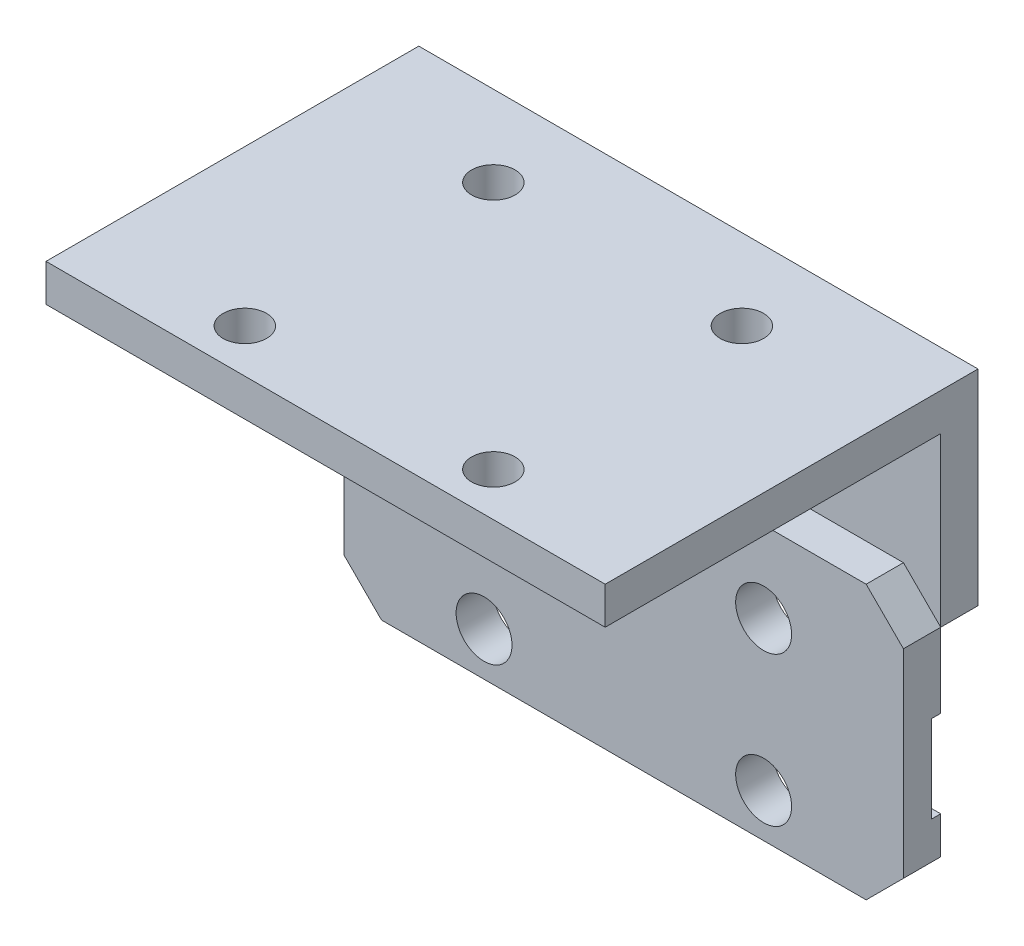
from build123d import *

# Parameters (mm, degrees)
SKETCH1_W                      = 45
SKETCH1_H                      = 27
BOSS_EXTRUDE1_DEPTH            = 3
CUT_EXTRUDE1_REACH             = 28.41
SKETCH2_R                      = 1.75
SKETCH3_W                      = 45
SKETCH3_H                      = 35.5
BOSS_EXTRUDE2_DEPTH            = 3
SKETCH4_W                      = 45
SKETCH4_H                      = 22
BOSS_EXTRUDE3_DEPTH            = 3
SKETCH6_W                      = 45
SKETCH6_H                      = 19
CUT_EXTRUDE2_DEPTH             = 3
SKETCH7_W                      = 1
SKETCH7_H                      = 7
CUT_EXTRUDE3_DEPTH             = 1.5
SKETCH8_W                      = 45
SKETCH8_H                      = 7
CUT_EXTRUDE4_DEPTH             = 0.75
CUT_EXTRUDE5_REACH             = 49.87
SKETCH10_R                     = 2.25
CUT_EXTRUDE5_DIRECTION_2_DEPTH = 48.86961458
CHAMFER1_SIZE                  = 3


with BuildPart() as part:
    # Sketch1 → Boss-Extrude1 (new body)
    with BuildSketch(Plane(origin=(0, 0, 0), x_dir=(1, 0, 0), z_dir=(0, 1, 0))):
        Rectangle(SKETCH1_W, SKETCH1_H)
    extrude(amount=BOSS_EXTRUDE1_DEPTH)

    # Sketch2 → Cut-Extrude1 (cut, up to next)
    with BuildSketch(Plane(origin=(0, 3, 0), x_dir=(1, 0, 0), z_dir=(0, 1, 0)), mode=Mode.PRIVATE) as cut_extrude1_sk1:
        with Locations(Location((-10, 10, 0), (0, 0, 270))):
            Circle(SKETCH2_R)
    cut_extrude1_tool1 = extrude(cut_extrude1_sk1.sketch, amount=-CUT_EXTRUDE1_REACH, mode=Mode.PRIVATE) & part.part
    # Sketch2 → Cut-Extrude1 (cut, up to next)
    with BuildSketch(Plane(origin=(0, 3, 0), x_dir=(1, 0, 0), z_dir=(0, 1, 0)), mode=Mode.PRIVATE) as cut_extrude1_sk2:
        with Locations(Location((10, 10, 0), (0, 0, 270))):
            Circle(SKETCH2_R)
    cut_extrude1_tool2 = extrude(cut_extrude1_sk2.sketch, amount=-CUT_EXTRUDE1_REACH, mode=Mode.PRIVATE) & part.part
    # Sketch2 → Cut-Extrude1 (cut, up to next)
    with BuildSketch(Plane(origin=(0, 3, 0), x_dir=(1, 0, 0), z_dir=(0, 1, 0)), mode=Mode.PRIVATE) as cut_extrude1_sk3:
        with Locations(Location((10, -10, 0), (0, 0, 270))):
            Circle(SKETCH2_R)
    cut_extrude1_tool3 = extrude(cut_extrude1_sk3.sketch, amount=-CUT_EXTRUDE1_REACH, mode=Mode.PRIVATE) & part.part
    # Sketch2 → Cut-Extrude1 (cut, up to next)
    with BuildSketch(Plane(origin=(0, 3, 0), x_dir=(1, 0, 0), z_dir=(0, 1, 0)), mode=Mode.PRIVATE) as cut_extrude1_sk4:
        with Locations(Location((-10, -10, 0), (0, 0, 270))):
            Circle(SKETCH2_R)
    cut_extrude1_tool4 = extrude(cut_extrude1_sk4.sketch, amount=-CUT_EXTRUDE1_REACH, mode=Mode.PRIVATE) & part.part
    add(cut_extrude1_tool1.solids().sort_by_distance((-10, 3, -10))[0], mode=Mode.SUBTRACT)
    add(cut_extrude1_tool2.solids().sort_by_distance((10, 3, -10))[0], mode=Mode.SUBTRACT)
    add(cut_extrude1_tool3.solids().sort_by_distance((10, 3, 10))[0], mode=Mode.SUBTRACT)
    add(cut_extrude1_tool4.solids().sort_by_distance((-10, 3, 10))[0], mode=Mode.SUBTRACT)

    # Sketch3 → Boss-Extrude2 (add)
    with BuildSketch(Plane(origin=(0, 0, -13.5), x_dir=(-1, 0, 0), z_dir=(0, 0, -1))):
        with Locations((0, -14.75)):
            Rectangle(SKETCH3_W, SKETCH3_H)
    extrude(amount=BOSS_EXTRUDE2_DEPTH)

    # Sketch4 → Boss-Extrude3 (add)
    with BuildSketch(Plane.XY.offset(-13.5)):
        with Locations((0, -21.5)):
            Rectangle(SKETCH4_W, SKETCH4_H)
    extrude(amount=BOSS_EXTRUDE3_DEPTH)

    # Sketch6 → Cut-Extrude2 (cut)
    with BuildSketch(Plane(origin=(0, 0, -16.5), x_dir=(-1, 0, 0), z_dir=(0, 0, -1))):
        with Locations((0, -23)):
            Rectangle(SKETCH6_W, SKETCH6_H)
    extrude(amount=-CUT_EXTRUDE2_DEPTH, mode=Mode.SUBTRACT)

    # Sketch7 → Cut-Extrude3 (cut)
    with BuildSketch(Plane(origin=(0, 0, -13.5), x_dir=(-1, 0, 0), z_dir=(0, 0, -1))):
        with Locations((19, -23)):
            Rectangle(SKETCH7_W, SKETCH7_H)
        with Locations((21, -23)):
            Rectangle(SKETCH7_W, SKETCH7_H)
        with Locations((17, -23)):
            Rectangle(SKETCH7_W, SKETCH7_H)
        with Locations((15, -23)):
            Rectangle(SKETCH7_W, SKETCH7_H)
        with Locations((13, -23)):
            Rectangle(SKETCH7_W, SKETCH7_H)
        with Locations((11, -23)):
            Rectangle(SKETCH7_W, SKETCH7_H)
        with Locations((9, -23)):
            Rectangle(SKETCH7_W, SKETCH7_H)
        with Locations((7, -23)):
            Rectangle(SKETCH7_W, SKETCH7_H)
        with Locations((5, -23)):
            Rectangle(SKETCH7_W, SKETCH7_H)
        with Locations((3, -23)):
            Rectangle(SKETCH7_W, SKETCH7_H)
        with Locations((1, -23)):
            Rectangle(SKETCH7_W, SKETCH7_H)
        with Locations((-1, -23)):
            Rectangle(SKETCH7_W, SKETCH7_H)
        with Locations((-3, -23)):
            Rectangle(SKETCH7_W, SKETCH7_H)
        with Locations((-5, -23)):
            Rectangle(SKETCH7_W, SKETCH7_H)
        with Locations((-7, -23)):
            Rectangle(SKETCH7_W, SKETCH7_H)
        with Locations((-9, -23)):
            Rectangle(SKETCH7_W, SKETCH7_H)
        with Locations((-11, -23)):
            Rectangle(SKETCH7_W, SKETCH7_H)
        with Locations((-13, -23)):
            Rectangle(SKETCH7_W, SKETCH7_H)
        with Locations((-15, -23)):
            Rectangle(SKETCH7_W, SKETCH7_H)
        with Locations((-17, -23)):
            Rectangle(SKETCH7_W, SKETCH7_H)
        with Locations((-19, -23)):
            Rectangle(SKETCH7_W, SKETCH7_H)
        with Locations((-21, -23)):
            Rectangle(SKETCH7_W, SKETCH7_H)
    extrude(amount=-CUT_EXTRUDE3_DEPTH, mode=Mode.SUBTRACT)

    # Sketch8 → Cut-Extrude4 (cut)
    with BuildSketch(Plane(origin=(0, 0, -13.5), x_dir=(-1, 0, 0), z_dir=(0, 0, -1))):
        with Locations((0, -23)):
            Rectangle(SKETCH8_W, SKETCH8_H)
    extrude(amount=-CUT_EXTRUDE4_DEPTH, mode=Mode.SUBTRACT)

    # Sketch10 → Cut-Extrude5 (cut, up to next)
    with BuildSketch(Plane(origin=(0, 0, -13.5), x_dir=(-1, 0, 0), z_dir=(0, 0, -1)), mode=Mode.PRIVATE) as cut_extrude5_sk1:
        with Locations(Location((11.25, -29, 0), (0, 0, 180))):
            Circle(SKETCH10_R)
    cut_extrude5_tool1 = extrude(cut_extrude5_sk1.sketch, amount=-CUT_EXTRUDE5_REACH, mode=Mode.PRIVATE) & part.part
    # Sketch10 → Cut-Extrude5 (cut, up to next)
    with BuildSketch(Plane(origin=(0, 0, -13.5), x_dir=(-1, 0, 0), z_dir=(0, 0, -1)), mode=Mode.PRIVATE) as cut_extrude5_sk2:
        with Locations(Location((11.25, -17, 0), (0, 0, 180))):
            Circle(SKETCH10_R)
    cut_extrude5_tool2 = extrude(cut_extrude5_sk2.sketch, amount=-CUT_EXTRUDE5_REACH, mode=Mode.PRIVATE) & part.part
    # Sketch10 → Cut-Extrude5 (cut, up to next)
    with BuildSketch(Plane(origin=(0, 0, -13.5), x_dir=(-1, 0, 0), z_dir=(0, 0, -1)), mode=Mode.PRIVATE) as cut_extrude5_sk3:
        with Locations(Location((-11.25, -17, 0), (0, 0, 180))):
            Circle(SKETCH10_R)
    cut_extrude5_tool3 = extrude(cut_extrude5_sk3.sketch, amount=-CUT_EXTRUDE5_REACH, mode=Mode.PRIVATE) & part.part
    # Sketch10 → Cut-Extrude5 (cut, up to next)
    with BuildSketch(Plane(origin=(0, 0, -13.5), x_dir=(-1, 0, 0), z_dir=(0, 0, -1)), mode=Mode.PRIVATE) as cut_extrude5_sk4:
        with Locations(Location((-11.25, -29, 0), (0, 0, 180))):
            Circle(SKETCH10_R)
    cut_extrude5_tool4 = extrude(cut_extrude5_sk4.sketch, amount=-CUT_EXTRUDE5_REACH, mode=Mode.PRIVATE) & part.part
    add(cut_extrude5_tool1.solids().sort_by_distance((-11.25, -29, -13.5))[0], mode=Mode.SUBTRACT)
    add(cut_extrude5_tool2.solids().sort_by_distance((-11.25, -17, -13.5))[0], mode=Mode.SUBTRACT)
    add(cut_extrude5_tool3.solids().sort_by_distance((11.25, -17, -13.5))[0], mode=Mode.SUBTRACT)
    add(cut_extrude5_tool4.solids().sort_by_distance((11.25, -29, -13.5))[0], mode=Mode.SUBTRACT)

    # Sketch10 → Cut-Extrude5 direction 2 (cut)
    with BuildSketch(Plane(origin=(0, 0, -13.5), x_dir=(-1, 0, 0), z_dir=(0, 0, -1))):
        with Locations(Location((11.25, -29, 0), (0, 0, 180))):
            Circle(SKETCH10_R)
        with Locations(Location((11.25, -17, 0), (0, 0, 180))):
            Circle(SKETCH10_R)
        with Locations(Location((-11.25, -17, 0), (0, 0, 180))):
            Circle(SKETCH10_R)
        with Locations(Location((-11.25, -29, 0), (0, 0, 180))):
            Circle(SKETCH10_R)
    extrude(amount=CUT_EXTRUDE5_DIRECTION_2_DEPTH, mode=Mode.SUBTRACT)

    # Chamfer1
    chamfer1_edges = [part.edges().sort_by_distance(p)[0] for p in [
        (22.5, -10.5, -12),
        (-22.5, -10.5, -12),
        (22.5, -32.5, -12),
        (-22.5, -32.5, -12),
    ]]
    chamfer(chamfer1_edges, length=CHAMFER1_SIZE - 0.0001)  # a hair under: the kernel refuses the full size


solid = part.part
